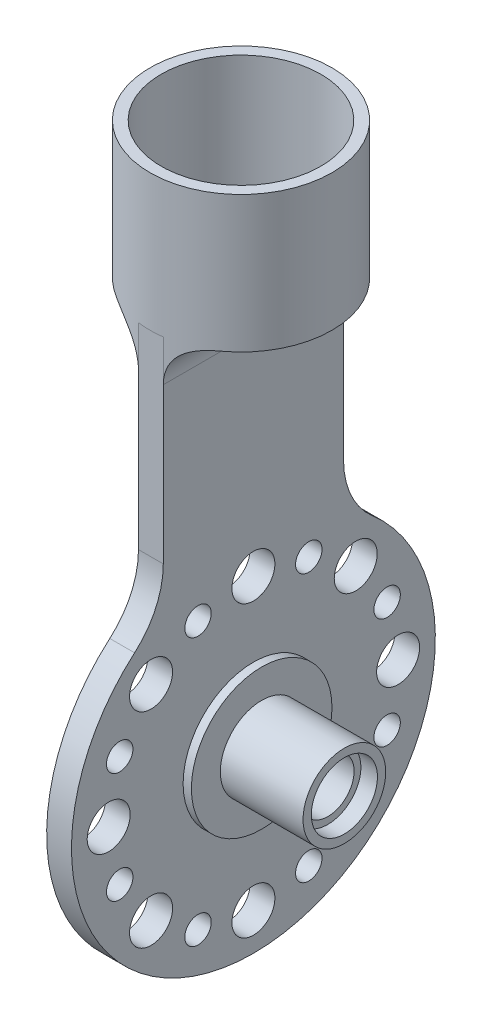
from build123d import *

# Parameters (mm, degrees)
SKETCH2_R            = 11
BOSS_EXTRUDE2_DEPTH  = 1.5
BOSS_EXTRUDE3_START  = -15
SKETCH3_R            = 11
SKETCH3_R_2          = 9.652
BOSS_EXTRUDE3_DEPTH  = 15
SKETCH4_W            = 3
SKETCH4_H            = 21.794494718
BOSS_EXTRUDE4_DEPTH  = 58
SKETCH11_R           = 8.5
BOSS_EXTRUDE11_DEPTH = 1
SKETCH8_R            = 5
BOSS_EXTRUDE6_DEPTH  = 10
SKETCH15_R           = 3.175
ENCODER_BED_DEPTH    = 6
FILLET5_R            = 10
FILLET7_R            = 5
SKETCH21_R           = 4
CUT_EXTRUDE6_DEPTH   = 2
SKETCH22_R           = 22
BOSS_EXTRUDE13_DEPTH = 3
SKETCH23_R           = 2.6
CUT_EXTRUDE7_DEPTH   = 3
CIRPATTERN1_COUNT    = 8
SKETCH24_R           = 1.6
CUT_EXTRUDE8_DEPTH   = 3
CIRPATTERN2_COUNT    = 8
FILLET8_R            = 10


with BuildPart() as part:
    # Sketch2 → Boss-Extrude2 (new body)
    with BuildSketch(Plane(origin=(0, 0, 0), x_dir=(-1, 0, 0), z_dir=(0, 1, 0))):
        with Locations(Location((0, 0, 0), (0, 0, 90))):
            Circle(SKETCH2_R)
    extrude(amount=-BOSS_EXTRUDE2_DEPTH)

    # Sketch3 → Boss-Extrude3 (add)
    with BuildSketch(Plane(origin=(0, 0, 0), x_dir=(-1, 0, 0), z_dir=(0, -1, 0)).offset(BOSS_EXTRUDE3_START)):
        with Locations(Location((0, 0, 0), (0, 0, 270))):
            Circle(SKETCH3_R)
        with Locations(Location((0, 0, 0), (0, 0, 90))):
            Circle(SKETCH3_R_2, mode=Mode.SUBTRACT)
    extrude(amount=BOSS_EXTRUDE3_DEPTH)

    # Sketch4 → Boss-Extrude4 (add)
    with BuildSketch(Plane.XZ.offset(1.5)):
        Rectangle(SKETCH4_W, SKETCH4_H)
    extrude(amount=BOSS_EXTRUDE4_DEPTH)

    # Sketch11 → Boss-Extrude11 (add)
    with BuildSketch(Plane(origin=(1.5, 0, 0), x_dir=(0, 0, -1), z_dir=(1, 0, 0))):
        with Locations(Location((0, -49.5, 0), (0, 0, 180))):
            Circle(SKETCH11_R)
    extrude(amount=BOSS_EXTRUDE11_DEPTH)

    # Sketch8 → Boss-Extrude6 (add)
    with BuildSketch(Plane.ZY.offset(-2.5)):
        with Locations((0, -49.5)):
            Circle(SKETCH8_R)
    extrude(amount=-BOSS_EXTRUDE6_DEPTH)

    # Sketch15 → encoder_bed (cut)
    with BuildSketch(Plane(origin=(12.5, 0, 0), x_dir=(0, 0, -1), z_dir=(1, 0, 0))):
        with Locations((0, -49.5)):
            Circle(SKETCH15_R)
    extrude(amount=-ENCODER_BED_DEPTH, mode=Mode.SUBTRACT)

    # Fillet5
    fillet5_edges = [part.edges().sort_by_distance(p)[0] for p in [
        (0, -59.5, 10.897247359),
        (0, -59.5, -10.897247359),
    ]]
    fillet(fillet5_edges, radius=FILLET5_R)

    # Fillet7
    # the kernel refuses this fillet: 5 mm, written as the material it adds along each edge
    with BuildSketch(Plane(origin=(1.5, -1.5, 10.897247359), x_dir=(0, -1, 0), z_dir=(0, 0, -1))) as fillet7_piece_1_section:
        with BuildLine():
            CenterArc((FILLET7_R, -FILLET7_R), FILLET7_R, 90, 90)
            Line((0, -FILLET7_R), (0, 0))
            Line((0, 0), (FILLET7_R, 0))
        make_face()
    fillet7_piece_1 = extrude(amount=21.794494718, mode=Mode.PRIVATE)
    fillet7_piece_1 = fillet7_piece_1 & Plane(origin=(0, -2.650343277, 0), x_dir=(0, 0, 1), z_dir=(0, 1, 0)) * Cylinder(11, 64, mode=Mode.PRIVATE)
    add(fillet7_piece_1)
    with BuildSketch(Plane(origin=(-1.5, -1.5, -10.897247359), x_dir=(0, -1, 0), z_dir=(0, 0, 1))) as fillet7_piece_2_section:
        with BuildLine():
            CenterArc((FILLET7_R, -FILLET7_R), FILLET7_R, 90, 90)
            Line((0, -FILLET7_R), (0, 0))
            Line((0, 0), (FILLET7_R, 0))
        make_face()
    fillet7_piece_2 = extrude(amount=21.794494718, mode=Mode.PRIVATE)
    fillet7_piece_2 = fillet7_piece_2 & Plane(origin=(0, -2.650343277, 0), x_dir=(0, 0, 1), z_dir=(0, 1, 0)) * Cylinder(11, 64, mode=Mode.PRIVATE)
    add(fillet7_piece_2)

    # Sketch21 → Cut-Extrude6 (cut)
    with BuildSketch(Plane(origin=(12.5, 0, 0), x_dir=(0, 0, -1), z_dir=(1, 0, 0))):
        with Locations((0, -49.5)):
            Circle(SKETCH21_R)
    extrude(amount=-CUT_EXTRUDE6_DEPTH, mode=Mode.SUBTRACT)

    # Sketch22 → Boss-Extrude13 (add)
    with BuildSketch(Plane.ZY.offset(1.5)):
        with Locations((0, -49.5)):
            Circle(SKETCH22_R)
    extrude(amount=-BOSS_EXTRUDE13_DEPTH)

    # Sketch23 → Cut-Extrude7 (cut)
    with BuildSketch(Plane.ZY.offset(1.5)):
        with Locations((0, -32)):
            Circle(SKETCH23_R)
    cut_extrude7 = extrude(amount=-CUT_EXTRUDE7_DEPTH, mode=Mode.SUBTRACT)

    # CirPattern1: Cut-Extrude7 ×8 about axis
    cirpattern1_axis = Axis((0, -49.5, 0), (1, 0, 0))
    for i in range(1, CIRPATTERN1_COUNT):
        add(cut_extrude7.rotate(cirpattern1_axis, i * 360 / CIRPATTERN1_COUNT), mode=Mode.SUBTRACT)

    # Sketch24 → Cut-Extrude8 (cut)
    with BuildSketch(Plane.ZY.offset(1.5)):
        with Locations((6.696960066, -33.332108181)):
            Circle(SKETCH24_R)
    cut_extrude8 = extrude(amount=-CUT_EXTRUDE8_DEPTH, mode=Mode.SUBTRACT)

    # CirPattern2: Cut-Extrude8 ×8 about axis
    cirpattern2_axis = Axis((0, -49.5, 0), (1, 0, 0))
    for i in range(1, CIRPATTERN2_COUNT):
        add(cut_extrude8.rotate(cirpattern2_axis, i * 360 / CIRPATTERN2_COUNT), mode=Mode.SUBTRACT)

    # Fillet8
    fillet8_edges = [part.edges().sort_by_distance(p)[0] for p in [
        (0, -30.388485146, -10.897247359),
        (0, -30.388485146, 10.897247359),
    ]]
    fillet(fillet8_edges, radius=FILLET8_R)


solid = part.part
